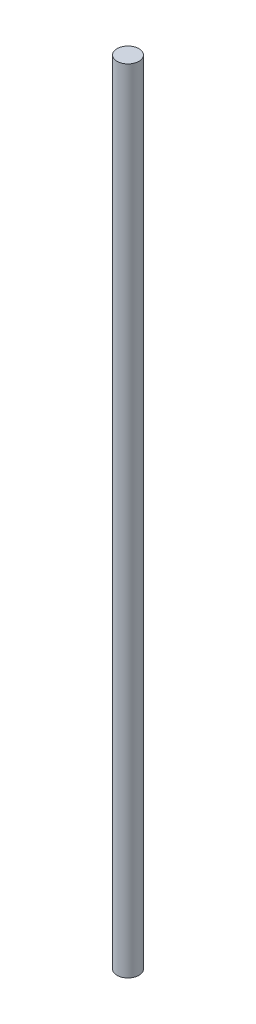
from build123d import *

# Parameters (mm, degrees)
SKETCH1_R  = 2.5
BODY_DEPTH = 180.5


with BuildPart() as part:
    # Sketch1 → Body (new body)
    with BuildSketch(Plane(origin=(0, 0, 0), x_dir=(1, 0, 0), z_dir=(0, 1, 0))):
        Circle(SKETCH1_R)
    extrude(amount=BODY_DEPTH)


solid = part.part
